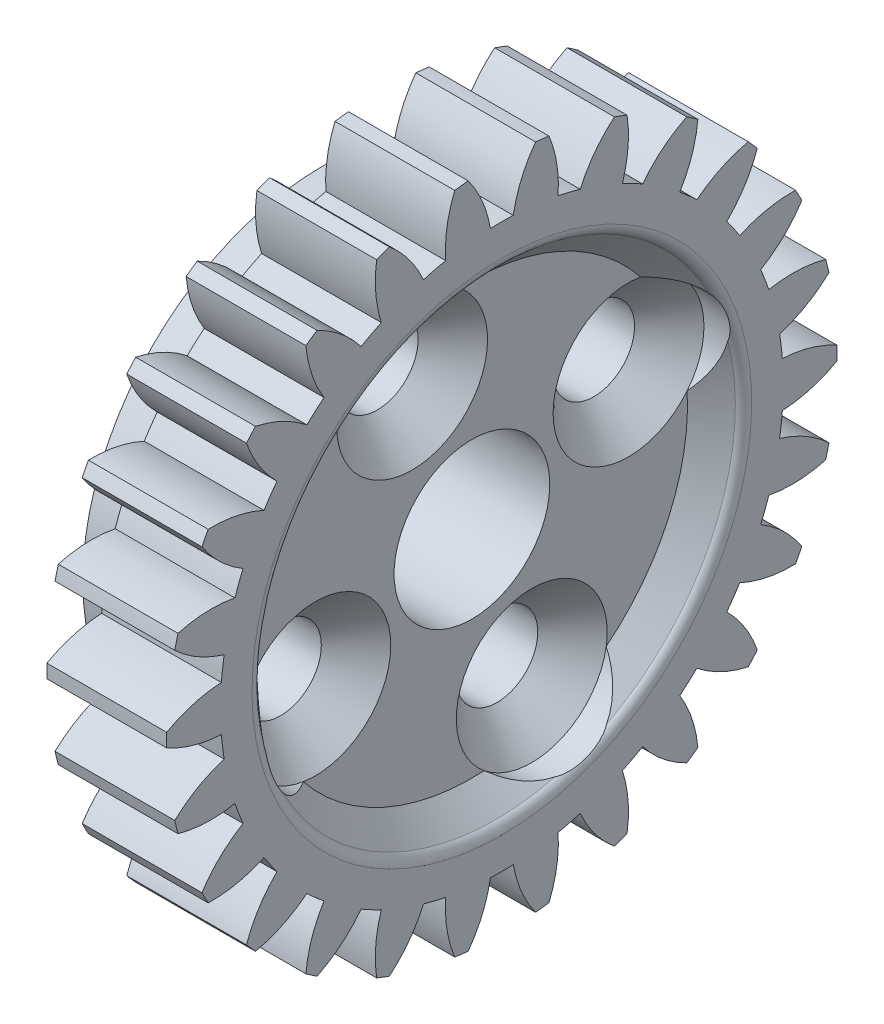
from build123d import *
from OCP.BRepAlgoAPI import BRepAlgoAPI_Cut
from OCP.TopTools import TopTools_ListOfShape

# Parameters (mm, degrees)
BASPROSKE_W           = 5
BASPROSKE_H           = 14
TOOTHCUT_DEPTH        = 21.420577857
TEETHCUTS_COUNT       = 26
TEETHCUTS_ANGLE       = 346.153846154
BORSKE_R              = 0.4
BORE_DEPTH            = 50.0000508
DELETEFACE1_OUTLINE_R = 0.4
DELETEFACE1_DEPTH     = 5
SKETCH1_R             = 10
BOSS_EXTRUDE1_DEPTH   = 2.5
SKETCH2_R             = 1.2645
CUT_EXTRUDE1_DEPTH    = 65.5
SKETCH3_R             = 10
CUT_EXTRUDE2_DEPTH    = 1.25
CUT_EXTRUDE3_START    = -4.25
CUT_EXTRUDE3_DEPTH    = 4.25
CHAMFER2_START        = 3.75
CHAMFER2_DEPTH        = 1.0000001
CHAMFER2_3_DEPTH      = 1.0000001
SKETCH7_R             = 3.25
CUT_EXTRUDE4_DEPTH    = 9.25


with BuildPart() as part:
    # BasProSke → Base-Revolve (revolve)
    with BuildSketch(Plane(origin=(0, 0, 0), x_dir=(1, 0, 0), z_dir=(0, 1, 0)), mode=Mode.PRIVATE) as base_revolve_sk:
        with Locations((2.5, 7)):
            Rectangle(BASPROSKE_W, BASPROSKE_H)
    revolve(base_revolve_sk.sketch.rotate(Axis((-10, 0, 0), (1, 0, 0)), 180), axis=Axis((-10, 0, 0), (1, 0, 0)))

    # TooCutSke → ToothCut (cut, through all)
    with BuildSketch(Plane(origin=(0, 0, 0), x_dir=(0, 0, -1), z_dir=(1, 0, 0))):
        with BuildLine():
            ThreePointArc((0.476965065, 11.739314517), (0, 11.749), (-0.476965065, 11.739314517))
            ThreePointArc((-0.476965065, 11.739314517), (-0.82065865, 12.901686978), (-1.424117301, 13.952911348))
            ThreePointArc((-1.424117301, 13.952911348), (0, 14.0254), (1.424117301, 13.952911348))
            ThreePointArc((1.424117301, 13.952911348), (0.82065865, 12.901686978), (0.476965065, 11.739314517))
        make_face()
    toothcut = extrude(amount=TOOTHCUT_DEPTH, mode=Mode.SUBTRACT)

    # TeethCuts: ToothCut ×26 about axis
    teethcuts_axis = Axis((-10, 0, 0), (1, 0, 0))
    for i in range(1, TEETHCUTS_COUNT):
        add(toothcut.rotate(teethcuts_axis, i * TEETHCUTS_ANGLE / (TEETHCUTS_COUNT - 1)), mode=Mode.SUBTRACT)

    # BorSke → Bore (cut, symmetric)
    with BuildSketch(Plane(origin=(0, 0, 0), x_dir=(0, 0, -1), z_dir=(1, 0, 0))):
        with Locations(Location((0, 0, 0), (0, 0, 180))):
            Circle(BORSKE_R)
    extrude(amount=BORE_DEPTH, both=True, mode=Mode.SUBTRACT)

    # DeleteFace1: read off the stored shape, not the designer's step
    # DeleteFace1 outline → DeleteFace1 (add)
    with BuildSketch(Plane.YZ):
        Circle(DELETEFACE1_OUTLINE_R)
    extrude(amount=DELETEFACE1_DEPTH)

    # Sketch1 → Boss-Extrude1 (add)
    with BuildSketch(Plane.ZY):
        with Locations(Location((0, 0, 0), (0, 0, 180))):
            Circle(SKETCH1_R)
    extrude(amount=BOSS_EXTRUDE1_DEPTH)

    # Sketch2 → Cut-Extrude1 (cut)
    with BuildSketch(Plane(origin=(-40.635398672, 0, 0), x_dir=(0, 0, -1), z_dir=(1, 0, 0))):
        with Locations(Location((-2.497676506, 6.539236352, 0), (0, 0, 180))):
            Circle(SKETCH2_R)
        with Locations(Location((6.539236352, 2.497676506, 0), (0, 0, 180))):
            Circle(SKETCH2_R)
        with Locations(Location((2.497676506, -6.539236352, 0), (0, 0, 180))):
            Circle(SKETCH2_R)
        with Locations(Location((-6.539236352, -2.497676506, 0), (0, 0, 180))):
            Circle(SKETCH2_R)
    extrude(amount=CUT_EXTRUDE1_DEPTH, mode=Mode.SUBTRACT)

    # Sketch3 → Cut-Extrude2 (cut)
    with BuildSketch(Plane(origin=(5, 0, 0), x_dir=(0, 0, -1), z_dir=(1, 0, 0))):
        Circle(SKETCH3_R)
    extrude(amount=-CUT_EXTRUDE2_DEPTH, mode=Mode.SUBTRACT)

    # CSK for M3 Flat Head Machine Screw1: read off the stored shape, not the designer's step
    # CSK for M3 Flat Head Machine Screw1 outl → CSK for M3 Flat Head Machine Screw1 (revolve, cut)
    with BuildSketch(Plane(origin=(0, -6.539236352, -2.497676506), x_dir=(0, 1, 0), z_dir=(0, 0, -1))):
        Polygon((1.7, 2.3), (3.15, 3.75), (1.2645, 3.75), (1.2645, -2.5), (1.7, -2.5), align=None)
    revolve(axis=Axis((0, -6.539236352, -2.497676506), (1, 0, 0)), mode=Mode.SUBTRACT)

    # CSK for M3 Flat Head Machine Screw1 2 ou → CSK for M3 Flat Head Machine Screw1 2 (revolve, cut)
    with BuildSketch(Plane(origin=(0, 2.497676506, -6.539236352), x_dir=(0, 1, 0), z_dir=(0, 0, -1))):
        Polygon((1.7, 2.3), (3.15, 3.75), (1.2645, 3.75), (1.2645, -2.5), (1.7, -2.5), align=None)
    revolve(axis=Axis((0, 2.497676506, -6.539236352), (1, 0, 0)), mode=Mode.SUBTRACT)

    # CSK for M3 Flat Head Machine Screw1 3 ou → CSK for M3 Flat Head Machine Screw1 3 (revolve, cut)
    with BuildSketch(Plane(origin=(0, 6.539236352, 2.497676506), x_dir=(0, 1, 0), z_dir=(0, 0, -1))):
        Polygon((1.7, 2.3), (3.15, 3.75), (1.2645, 3.75), (1.2645, -2.5), (1.7, -2.5), align=None)
    revolve(axis=Axis((0, 6.539236352, 2.497676506), (1, 0, 0)), mode=Mode.SUBTRACT)

    # CSK for M3 Flat Head Machine Screw1 4 ou → CSK for M3 Flat Head Machine Screw1 4 (revolve, cut)
    with BuildSketch(Plane(origin=(0, -2.497676506, 6.539236352), x_dir=(0, 1, 0), z_dir=(0, 0, -1))):
        Polygon((1.7, 2.3), (3.15, 3.75), (1.2645, 3.75), (1.2645, -2.5), (1.7, -2.5), align=None)
    revolve(axis=Axis((0, -2.497676506, 6.539236352), (1, 0, 0)), mode=Mode.SUBTRACT)

    # Sketch6 → Cut-Extrude3 (cut)
    with BuildSketch(Plane.ZY.offset(-3.75).offset(CUT_EXTRUDE3_START)):
        with BuildLine():
            ThreePointArc((-4.615245628, -8.871274305), (-3.621630933, -9.481892711), (-2.473950376, -9.689146997))
            ThreePointArc((-2.473950376, -9.689146997), (-3.568109294, -9.341766218), (-4.615245628, -8.871274305))
        make_face()
        with BuildLine():
            ThreePointArc((-8.871274305, 4.615245628), (-9.341766218, 3.568109294), (-9.689146997, 2.473950376))
            ThreePointArc((-9.689146997, 2.473950376), (-9.481892711, 3.621630933), (-8.871274305, 4.615245628))
        make_face()
        with BuildLine():
            ThreePointArc((4.615245628, 8.871274305), (3.621630933, 9.481892711), (2.473950376, 9.689146997))
            ThreePointArc((2.473950376, 9.689146997), (3.568109294, 9.341766218), (4.615245628, 8.871274305))
        make_face()
        with BuildLine():
            ThreePointArc((8.871274305, -4.615245628), (9.481892711, -3.621630933), (9.689146997, -2.473950376))
            ThreePointArc((9.689146997, -2.473950376), (9.341766218, -3.568109294), (8.871274305, -4.615245628))
        make_face()
    extrude(amount=CUT_EXTRUDE3_DEPTH, mode=Mode.SUBTRACT)

    # Chamfer2: read off the stored shape, not the designer's step
    # Chamfer2 outline → Chamfer2 (add)
    with BuildSketch(Plane.YZ.offset(CHAMFER2_START)):
        with BuildLine():
            ThreePointArc((-9.689146997, -2.473950376), (-9.481892711, -3.621630933), (-8.871274305, -4.615245628))
            ThreePointArc((-8.871274305, -4.615245628), (-4.082591963, -9.128660518), (2.473950376, -9.689146997))
            ThreePointArc((2.473950376, -9.689146997), (3.621630933, -9.481892711), (4.615245628, -8.871274305))
            ThreePointArc((4.615245628, -8.871274305), (9.128660518, -4.082591963), (9.689146997, 2.473950376))
            ThreePointArc((9.689146997, 2.473950376), (9.481892711, 3.621630933), (8.871274305, 4.615245628))
            ThreePointArc((8.871274305, 4.615245628), (4.082591963, 9.128660518), (-2.473950376, 9.689146997))
            ThreePointArc((-2.473950376, 9.689146997), (-3.621630933, 9.481892711), (-4.615245628, 8.871274305))
            ThreePointArc((-4.615245628, 8.871274305), (-9.128660518, 4.082591963), (-9.689146997, -2.473950376))
        make_face()
    extrude(amount=CHAMFER2_DEPTH)

    # Chamfer2 2 outline → Chamfer2 2 (revolve, cut)
    with BuildSketch(Plane.YX):
        Polygon((0, 4.75), (0, 3.75), (9, 3.75), (10, 4.75), align=None)
    revolve(axis=Axis((0, 0, 0), (1, 0, 0)), mode=Mode.SUBTRACT)

    # Chamfer2 3 outline → Chamfer2 3 (cut)
    with BuildSketch(Plane.YZ.offset(CHAMFER2_START)):
        with BuildLine():
            Line((-7.039431424, -5.607709446), (-2.811998815, -6.287618951))
            Line((-2.811998815, -6.287618951), (-7.181013124, -2.74280463))
            Line((-7.181013124, -2.74280463), (-6.287618951, 2.811998815))
            Line((-6.287618951, 2.811998815), (-8.985367619, -0.51299975))
            ThreePointArc((-8.985367619, -0.51299975), (-9.481892711, -3.621630933), (-7.039431424, -5.607709446))
        make_face()
        with BuildLine():
            Line((2.74280463, -7.181013124), (-2.811998815, -6.287618951))
            Line((-2.811998815, -6.287618951), (0.51299975, -8.985367619))
            ThreePointArc((0.51299975, -8.985367619), (3.621630933, -9.481892711), (5.607709446, -7.039431424))
            Line((5.607709446, -7.039431424), (6.287618951, -2.811998815))
            Line((6.287618951, -2.811998815), (2.74280463, -7.181013124))
        make_face()
        with BuildLine():
            Line((-5.607709446, 7.039431424), (-6.287618951, 2.811998815))
            Line((-6.287618951, 2.811998815), (-2.74280463, 7.181013124))
            Line((-2.74280463, 7.181013124), (2.811998815, 6.287618951))
            Line((2.811998815, 6.287618951), (-0.51299975, 8.985367619))
            ThreePointArc((-0.51299975, 8.985367619), (-3.621630933, 9.481892711), (-5.607709446, 7.039431424))
        make_face()
        with BuildLine():
            Line((7.181013124, 2.74280463), (6.287618951, -2.811998815))
            Line((6.287618951, -2.811998815), (8.985367619, 0.51299975))
            ThreePointArc((8.985367619, 0.51299975), (9.481892711, 3.621630933), (7.039431424, 5.607709446))
            Line((7.039431424, 5.607709446), (2.811998815, 6.287618951))
            Line((2.811998815, 6.287618951), (7.181013124, 2.74280463))
        make_face()
    extrude(amount=CHAMFER2_3_DEPTH, mode=Mode.SUBTRACT)


with BuildPart() as fillet1_tool:
    # Fillet1: read off the stored shape, not the designer's step
    # Fillet1 outline → Fillet1 (revolve)
    with BuildSketch(Plane.YX):
        with BuildLine():
            Line((10, 5), (9.999999135, 4.749998502))
            ThreePointArc((9.999999135, 4.749998502), (10.183011953, 4.93301227), (10.433012702, 5))
            Line((10.433012702, 5), (10, 5))
        make_face()
    revolve(axis=Axis((0, 0, 0), (1, 0, 0)))


with BuildPart() as part_1:
    add(part.part)

    # Fillet1: cut by fillet1_tool, with a tolerance
    fillet1_stock = TopTools_ListOfShape()
    fillet1_stock.Append(part_1.part.wrapped)
    fillet1_tools = TopTools_ListOfShape()
    fillet1_tools.Append(fillet1_tool.part.wrapped)
    fillet1_cut = BRepAlgoAPI_Cut()
    fillet1_cut.SetArguments(fillet1_stock)
    fillet1_cut.SetTools(fillet1_tools)
    fillet1_cut.SetFuzzyValue(0.00001)
    fillet1_cut.Build()
    add(Compound.cast(fillet1_cut.Shape()).solids(), mode=Mode.REPLACE)

    # Sketch7 → Cut-Extrude4 (cut)
    with BuildSketch(Plane(origin=(3.75, 0, 0), x_dir=(0, 0, -1), z_dir=(1, 0, 0))):
        Circle(SKETCH7_R)
    extrude(amount=-CUT_EXTRUDE4_DEPTH, mode=Mode.SUBTRACT)


solid = part_1.part
